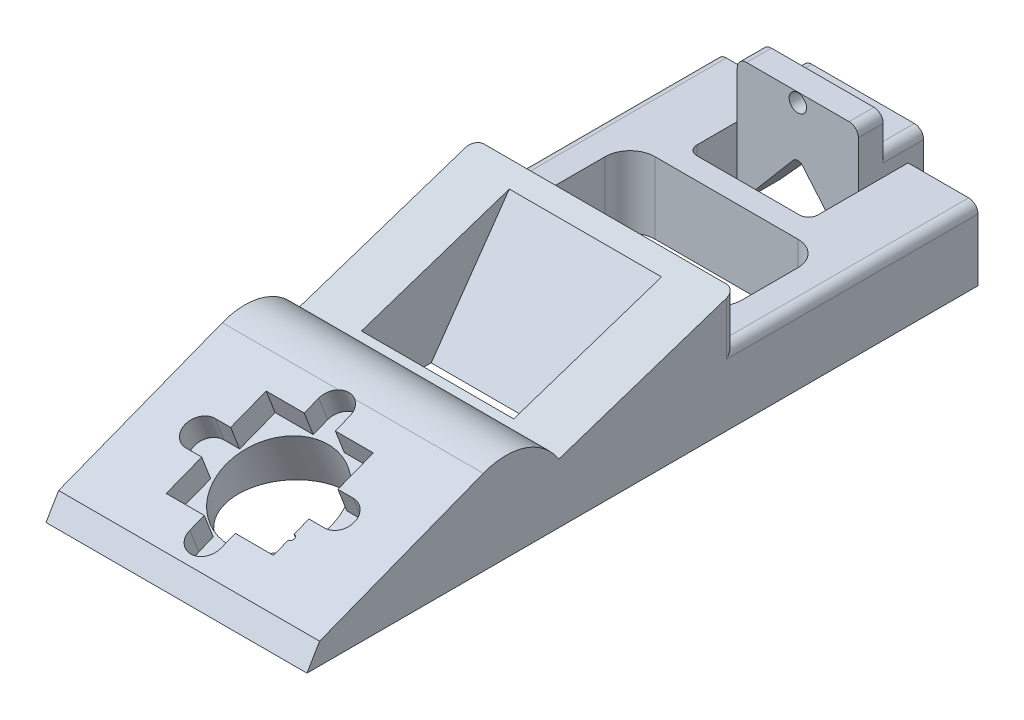
from build123d import *

# Parameters (mm, degrees)
EXTRUDE_1_DEPTH          = 19
CUT_EXTRUDE_1_REACH      = 60.798
CUT_EXTRUDE_2_DEPTH      = 19
SKETCH_5_W               = 19.5
SKETCH_5_H               = 3.999999999999993
EXTRUDE_2_DEPTH          = 9
EXTRUDE_3_DEPTH          = 3.5
EXTRUDE_3_DEPTH_BACK     = 11.5
CUT_EXTRUDE_3_REACH      = 83.003
FILLET_1_R               = 1.5
FILLET_2_R               = 1
CUT_EXTRUDE_4_DEPTH      = 19.999999999999996
FILLET_3_R               = 1.5
CUT_EXTRUDE_15_DEPTH     = 2
SKETCH_18_R              = 0.7500000000000009
CUT_EXTRUDE_16_DEPTH     = 4
SKETCH_20_R              = 0.7500000000000004
CUT_EXTRUDE_18_DEPTH     = 4
CUT_EXTRUDE_18_DRAFT     = -5.000000000000011
MIRROR_1_COPY_1_SKETCH_R = 0.7500000000000004
MIRROR_1_COPY_1_DEPTH    = 4
MIRROR_1_COPY_1_DRAFT    = -5.000000000000011
FILLET_7_R               = 1.5
CUT_EXTRUDE_22_DEPTH     = 24.000000000000007
EXTRUDE_4_DEPTH          = 42
SKETCH_24_R              = 2.499999999999999
SKETCH_24_R_2            = 2.500000000000004
CUT_EXTRUDE_23_DEPTH     = 4
SKETCH_25_R              = 8.5
CUT_EXTRUDE_24_DEPTH     = 70.91291338858937
CUT_EXTRUDE_25_DEPTH     = 70.94027802815528
EXTRUDE_5_DEPTH          = 24.5
FILLET_8_R               = 10
CUT_EXTRUDE_26_DEPTH     = 36.000000000000014


with BuildPart() as part:
    # 草图1 → 凸台-拉伸1 (new body)
    with BuildSketch(Plane(origin=(0, 0, 0), x_dir=(1, 0, 0), z_dir=(0, 1, 0))):
        Polygon((-20.999999999999996, 36.499999999999986), (21.000000000000004, 36.499999999999986), (21.00000000000001, -36.500000000000014), (-20.999999999999986, -36.500000000000014), align=None)
    extrude(amount=EXTRUDE_1_DEPTH)

    # 草图3 → 切除-拉伸1 (cut, up to next)
    with BuildSketch(Plane.ZY.offset(20.999999999999993), mode=Mode.PRIVATE) as cut_extrude_1_sk1:
        Polygon((-36.499999999999986, 19), (-36.499999999999986, 11.5), (2.500000000000014, 11.5), (2.500000000000016, 19), align=None)
    cut_extrude_1_tool1 = extrude(cut_extrude_1_sk1.sketch, amount=-CUT_EXTRUDE_1_REACH, mode=Mode.PRIVATE) & part.part
    # 草图3 → 切除-拉伸1 (cut, up to next)
    with BuildSketch(Plane.ZY.offset(20.999999999999993), mode=Mode.PRIVATE) as cut_extrude_1_sk2:
        Polygon((36.500000000000014, 19), (2.500000000000014, 19), (30.977695197165154, 9.564912493391638), (36.500000000000014, 0), align=None)
    cut_extrude_1_tool2 = extrude(cut_extrude_1_sk2.sketch, amount=-CUT_EXTRUDE_1_REACH, mode=Mode.PRIVATE) & part.part
    add(cut_extrude_1_tool1.solids().sort_by_distance((-21, 15.25, -17))[0], mode=Mode.SUBTRACT)
    add(cut_extrude_1_tool2.solids().sort_by_distance((-21, 14.294033, 26.119155))[0], mode=Mode.SUBTRACT)

    # 草图4 → 切除-拉伸2 (cut)
    with BuildSketch(Plane(origin=(0, 11.5, 0), x_dir=(1, 0, 0), z_dir=(0, 1, 0))):
        with BuildLine():
            ThreePointArc((-8.249999999999991, 20.499999999999986), (-9.310660171779816, 20.939339828220167), (-9.749999999999991, 21.99999999999999))
            Line((-9.749999999999991, 21.99999999999999), (-9.749999999999991, 28.49999999999999))
            Line((-9.749999999999991, 28.49999999999999), (9.750000000000009, 28.49999999999999))
            Line((9.750000000000009, 28.49999999999999), (9.750000000000009, 21.999999999999993))
            ThreePointArc((9.750000000000009, 21.999999999999993), (9.31066017177983, 20.93933982822017), (8.250000000000009, 20.49999999999999))
            Line((8.250000000000009, 20.49999999999999), (-8.249999999999991, 20.499999999999986))
        make_face()
    extrude(amount=-CUT_EXTRUDE_2_DEPTH, mode=Mode.SUBTRACT)

    # 草图5 → 凸台-拉伸2 (add)
    with BuildSketch(Plane(origin=(0, 11.5, 0), x_dir=(1, 0, 0), z_dir=(0, 1, 0))):
        with Locations((8.88e-15, 30.49999999999999)):
            Rectangle(SKETCH_5_W, SKETCH_5_H)
    extrude(amount=EXTRUDE_2_DEPTH)

    # 草图6 → 凸台-拉伸3 (add, two sides: drawn at the far end of the back side and taken through both)
    with BuildSketch(Plane(origin=(0, 11.5, 0), x_dir=(1, 0, 0), z_dir=(0, 1, 0)).offset(-EXTRUDE_3_DEPTH_BACK)):
        Polygon((-9.749999999999991, 32.499999999999986), (-9.749999999999991, 38.999999999999986), (9.750000000000007, 38.999999999999986), (9.750000000000009, 32.499999999999986), align=None)
    extrude(amount=EXTRUDE_3_DEPTH + EXTRUDE_3_DEPTH_BACK)

    # 草图7 → 切除-拉伸3 (cut, up to next)
    with BuildSketch(Plane(origin=(0, 0, -38.999999999999986), x_dir=(-1, 0, 0), z_dir=(0, 0, -1)), mode=Mode.PRIVATE) as cut_extrude_3_sk1:
        Polygon((0, 11.500000000000002), (9.749999999999991, 0), (-9.750000000000007, -6.94e-15), align=None)
    cut_extrude_3_tool1 = extrude(cut_extrude_3_sk1.sketch, amount=-CUT_EXTRUDE_3_REACH, mode=Mode.PRIVATE) & part.part
    add(cut_extrude_3_tool1.solids().sort_by_distance((0, 3.833333, -39))[0], mode=Mode.SUBTRACT)

    # 圆角1
    fillet_1_edges = [part.edges().sort_by_distance(p)[0] for p in [
        (9.750000000000009, 20.5, -30.499999999999986),
        (-9.749999999999991, 20.5, -30.499999999999986),
        (9.750000000000007, 15, -35.749999999999986),
        (-9.749999999999991, 15, -35.749999999999986),
    ]]
    fillet(fillet_1_edges, radius=FILLET_1_R)

    # 圆角2
    fillet_2_edges = [part.edges().sort_by_distance(p)[0] for p in [
        (0, 11.500000000000002, -33.749999999999986),
    ]]
    fillet(fillet_2_edges, radius=FILLET_2_R)

    # 草图8 → 切除-拉伸4 (cut)
    with BuildSketch(Plane(origin=(9.750000000000009, 0, 0), x_dir=(0, 0, -1), z_dir=(1, 0, 0))):
        Polygon((36.499999999999986, 0), (38.999999999999986, 4), (38.999999999999986, 0), align=None)
    extrude(amount=-CUT_EXTRUDE_4_DEPTH, mode=Mode.SUBTRACT)

    # 圆角3
    fillet_3_edges = [part.edges().sort_by_distance(p)[0] for p in [
        (8.054347826086955, 2.0000000000000036, -37.74999999999998),
        (-8.054347826086952, 1.9999999999999991, -37.749999999999986),
    ]]
    fillet(fillet_3_edges, radius=FILLET_3_R)

    # 草图17 → 切除-拉伸15 (cut)
    with BuildSketch(Plane(origin=(0, 0, -28.49999999999999), x_dir=(-1, 0, 0), z_dir=(0, 0, -1))):
        with BuildLine():
            ThreePointArc((1.39999999999999, 18.999999999999996), (-8.59e-15, 20.399999999999995), (-1.4000000000000072, 18.999999999999996))
            Line((-1.4000000000000075, 18.999999999999996), (1.3999999999999897, 18.999999999999996))
        make_face()
        with BuildLine():
            Line((1.3999999999999897, 18.999999999999996), (-1.4000000000000075, 18.999999999999996))
            ThreePointArc((-1.4000000000000072, 18.999999999999996), (-8.93e-15, 17.599999999999998), (1.39999999999999, 18.999999999999996))
        make_face()
    extrude(amount=CUT_EXTRUDE_15_DEPTH, mode=Mode.SUBTRACT)

    # 草图18 → 切除-拉伸16 (cut)
    with BuildSketch(Plane.XY.offset(-30.499999999999993)):
        with Locations((8.67e-15, 18.999999999999996)):
            Circle(SKETCH_18_R)
    extrude(amount=-CUT_EXTRUDE_16_DEPTH, mode=Mode.SUBTRACT)


with BuildPart() as cut_extrude_18_tool:
    # 草图20 → 切除-拉伸18 (with draft: the straight prism first)
    with BuildSketch(Plane(origin=(0, 0, -36.499999999999986), x_dir=(-1, 0, 0), z_dir=(0, 0, -1))):
        with Locations((-15.250000000000005, 5.75)):
            Circle(SKETCH_20_R)
    extrude(amount=-CUT_EXTRUDE_18_DEPTH)
    # 切除-拉伸18: the draft: its side faces are tilted about the plane it starts from
    cut_extrude_18_sides = [cut_extrude_18_tool.faces().sort_by_distance(p)[0] for p in [
        (16, 5.75, -34.5),
    ]]
    draft(cut_extrude_18_sides, Plane(origin=(0, 0, -36.499999999999986), x_dir=(-1, 0, 0), z_dir=(0, 0, -1)), CUT_EXTRUDE_18_DRAFT)


with BuildPart() as part_1:
    add(part.part)

    # 切除-拉伸18: cut by cut_extrude_18_tool
    add(cut_extrude_18_tool.part, mode=Mode.SUBTRACT)


with BuildPart() as mirror_1_copy_1_tool:
    # 镜向1 copy 1 sketch → 镜向1 copy 1 (with draft: the straight prism first)
    with BuildSketch(Plane(origin=(0, 0, -36.499999999999986), x_dir=(1, 0, 0), z_dir=(0, 0, -1))):
        with Locations((-15.250000000000005, -5.75)):
            Circle(MIRROR_1_COPY_1_SKETCH_R)
    extrude(amount=-MIRROR_1_COPY_1_DEPTH)
    # 镜向1 copy 1: the draft: its side faces are tilted about the plane it starts from
    mirror_1_copy_1_sides = [mirror_1_copy_1_tool.faces().sort_by_distance(p)[0] for p in [
        (-16, 5.75, -34.5),
    ]]
    draft(mirror_1_copy_1_sides, Plane(origin=(0, 0, -36.499999999999986), x_dir=(1, 0, 0), z_dir=(0, 0, -1)), MIRROR_1_COPY_1_DRAFT)


with BuildPart() as part_2:
    add(part_1.part)

    # 镜向1 copy 1: cut by mirror_1_copy_1_tool
    add(mirror_1_copy_1_tool.part, mode=Mode.SUBTRACT)

    # 圆角7
    fillet_7_edges = [part_2.edges().sort_by_distance(p)[0] for p in [
        (-20.999999999999996, 11.5, -16.999999999999982),
        (-20.999999999999993, 15.25, 2.500000000000019),
        (21.000000000000007, 15.25, 2.5000000000000138),
        (21.000000000000007, 11.5, -16.999999999999986),
    ]]
    fillet(fillet_7_edges, radius=FILLET_7_R)

    # 草图21 → 切除-拉伸22 (cut)
    with BuildSketch(Plane.XZ):
        Polygon((-12.24999999999999, 29.47769519716515), (-12.24999999999999, 5.683244946958155), (12.250000000000012, 5.683244946958155), (12.25000000000001, 29.477695197165154), align=None)
    extrude(amount=-CUT_EXTRUDE_22_DEPTH, mode=Mode.SUBTRACT)

    # 草图23 → 凸台-拉伸4 (add)
    with BuildSketch(Plane(origin=(21.000000000000007, 0, -2e-15), x_dir=(-1e-16, 0, -1), z_dir=(1, 0, -1e-16))):
        Polygon((-30.977695197165158, 9.564912493391638), (-30.977695197165158, 18.364912493391635), (-69.46824654038242, 3.445573664766443), (-71.50000000000001, 0), (-36.50000000000001, 0), align=None)
    extrude(amount=-EXTRUDE_4_DEPTH)

    # 草图24 → 切除-拉伸23 (cut)
    with BuildSketch(Plane(origin=(9.7e-16, 26.405047147072228, 10.23487145352138), x_dir=(1, -3e-17, -1e-17), z_dir=(0, 0.9324067733233699, 0.36141058238615825))):
        Polygon((-9.624999999999988, -57.15239682031271), (-9.624999999999988, -39.90239682031272), (7.625000000000015, -39.90239682031271), (7.625000000000015, -57.15239682031271), align=None)
        with Locations((10.125000000000002, -48.527396820312816)):
            Circle(SKETCH_24_R)
        with BuildLine():
            Line((7.625000000000015, -48.527396820312816), (7.625000000000015, -51.0273968203127))
            Line((7.625000000000007, -51.0273968203127), (10.125000000000009, -51.0273968203127))
            ThreePointArc((10.125000000000007, -51.027396820312816), (8.357233047033636, -50.295163773279185), (7.625000000000003, -48.527396820312816))
        make_face()
        with BuildLine():
            Line((7.625000000000015, -46.0273968203127), (7.625000000000015, -48.527396820312816))
            ThreePointArc((7.625000000000003, -48.527396820312816), (8.357233047033636, -46.75962986734645), (10.125000000000009, -46.027396820312816))
            Line((10.125000000000009, -46.0273968203127), (7.625000000000013, -46.0273968203127))
        make_face()
        with Locations((-12.12499999999999, -48.52739682031258)):
            Circle(SKETCH_24_R)
        with BuildLine():
            Line((-12.124999999999996, -51.027396820312674), (-9.624999999999988, -51.02739682031271))
            Line((-9.624999999999988, -51.02739682031271), (-9.624999999999988, -48.52739682031258))
            ThreePointArc((-9.62499999999999, -48.52739682031258), (-10.357233047033622, -50.29516377327895), (-12.124999999999996, -51.02739682031258))
        make_face()
        with BuildLine():
            ThreePointArc((-12.124999999999977, -46.02739682031258), (-10.357233047033617, -46.75962986734622), (-9.62499999999999, -48.52739682031258))
            Line((-9.624999999999988, -48.52739682031258), (-9.624999999999988, -46.0273968203127))
            Line((-9.624999999999988, -46.0273968203127), (-12.124999999999977, -46.027396820312674))
        make_face()
        with Locations((-0.9999999999999847, -37.40239682031271)):
            Circle(SKETCH_24_R_2)
        with BuildLine():
            Line((-0.9999999434812805, -39.90239682031271), (1.500000000000015, -39.90239682031271))
            Line((1.500000000000015, -39.90239682031272), (1.500000000000015, -37.40239682031271))
            ThreePointArc((1.5000000000000193, -37.40239682031271), (0.7677669729487664, -39.1701637532967), (-0.9999999434812799, -39.90239682031272))
        make_face()
        with BuildLine():
            Line((-3.499999999999985, -39.90239682031272), (-0.9999999434812805, -39.90239682031271))
            ThreePointArc((-0.9999999434812799, -39.90239682031272), (-2.7677669329839762, -39.17016379326146), (-3.4999999999999885, -37.40239682031271))
            Line((-3.499999999999984, -37.40239682031271), (-3.499999999999984, -39.90239682031271))
        make_face()
        with Locations((-1.000000000000067, -59.65239682031271)):
            Circle(SKETCH_24_R_2)
        with BuildLine():
            ThreePointArc((-1.0000000349305498, -57.1523968203127), (0.7677669406165137, -57.88462985499655), (1.499999999999937, -59.65239682031271))
            Line((1.500000000000015, -59.6523968203127), (1.500000000000015, -57.1523968203127))
            Line((1.500000000000015, -57.15239682031271), (-1.00000003493055, -57.15239682031271))
        make_face()
        with BuildLine():
            Line((-3.499999999999984, -57.15239682031271), (-3.499999999999984, -59.6523968203127))
            ThreePointArc((-3.500000000000071, -59.65239682031271), (-2.767766965316229, -57.88462987969613), (-1.0000000349305498, -57.1523968203127))
            Line((-1.00000003493055, -57.15239682031271), (-3.499999999999985, -57.15239682031271))
        make_face()
    extrude(amount=-CUT_EXTRUDE_23_DEPTH, mode=Mode.SUBTRACT)

    # 草图25 → 切除-拉伸24 (cut, through all)
    with BuildSketch(Plane(origin=(-6.7e-16, 22.67542005377876, 8.789229123976755), x_dir=(1, 3e-17, 1e-17), z_dir=(0, 0.9324067733233699, 0.3614105823861583))):
        with Locations(Location((-0.9999999999999868, -48.52739682031273, 0), (0, 0, 270))):
            Circle(SKETCH_25_R)
    extrude(amount=-CUT_EXTRUDE_24_DEPTH, mode=Mode.SUBTRACT)

    # 草图27 → 切除-拉伸25 (cut, through all)
    with BuildSketch(Plane(origin=(9.7e-16, 26.405047147072228, 10.23487145352138), x_dir=(1, -3e-17, -1e-17), z_dir=(0, 0.9324067733233699, 0.36141058238615825))):
        with BuildLine():
            ThreePointArc((7.625, -53.58989682031273), (7.125000000000012, -54.08989682031273), (7.624999999999999, -54.58989682031273))
            Line((7.625000000000016, -54.58989682031273), (7.625000000000016, -53.58989682031273))
        make_face()
        with BuildLine():
            Line((7.625000000000016, -53.58989682031273), (7.625000000000016, -54.58989682031273))
            ThreePointArc((7.624999999999999, -54.58989682031273), (7.978553390593286, -54.443450210906015), (8.12500000000002, -54.08989682031273))
            ThreePointArc((8.12500000000002, -54.08989682031273), (7.978553390593286, -53.73634342971945), (7.625, -53.58989682031273))
        make_face()
    extrude(amount=-CUT_EXTRUDE_25_DEPTH, mode=Mode.SUBTRACT)

    # 草图28 → 凸台-拉伸5 (add)
    with BuildSketch(Plane(origin=(-12.24999999999999, 0, 0), x_dir=(0, 0, -1), z_dir=(1, 0, 0))):
        Polygon((-5.683244946958155, 0), (-5.683244946958155, 17.94534320907723), (-18.248709537714582, 0), align=None)
    extrude(amount=EXTRUDE_5_DEPTH)

    # 圆角8
    # the kernel refuses this fillet: 10 mm, written as the material it takes off along each edge
    with BuildSketch(Plane(origin=(53.54506406890172, 18.364912493391635, 30.97769519716515), x_dir=(0, -1, -4e-16), z_dir=(-1, 0, 1e-16))) as fillet_8_piece_1:
        with BuildLine():
            CenterArc((14.028919956808336, 8.523989446573212), FILLET_8_R, 158.81314998741195, 79.6604084684634)
            Line((4.704852223574637, 12.138095270434794), (4.5183708689099635, 12.210377386912027))
            Line((4.5183708689099635, 12.210377386912027), (-0.1864813546646751, 0.07228211647723264))
            Line((-0.1864813546646751, 0.07228211647723264), (8e-17, -0.1999999999999993))
            ThreePointArc((8e-17, -0.1999999999999993), (4.399999999999999, -0.1999999999999975), (8.695421600863831, -0.1704797889314627))
            Line((8.695421600863831, -0.1704797889314627), (8.799999999999997, 0))
        make_face()
    extrude(amount=107.09012813780342, mode=Mode.SUBTRACT)

    # 草图30 → 切除-拉伸26 (cut)
    with BuildSketch(Plane(origin=(0, 11.5, 0), x_dir=(1, 0, 0), z_dir=(0, 1, 0))):
        with BuildLine():
            Line((11.499999999999979, -8.4e-16), (-11.499999999999968, -3.66e-15))
            ThreePointArc((-11.499999999999968, -3.66e-15), (-14.328427124746186, 1.1715728752538062), (-15.499999999999996, 4.000000000000024))
            Line((-15.499999999999996, 4.000000000000024), (-15.499999999999996, 12.999999999999948))
            ThreePointArc((-15.499999999999996, 12.999999999999948), (-14.328427124746188, 15.828427124746169), (-11.499999999999968, 16.99999999999998))
            Line((-11.499999999999968, 16.99999999999998), (11.499999999999975, 16.999999999999982))
            ThreePointArc((11.499999999999975, 16.999999999999982), (14.328427124746195, 15.828427124746174), (15.500000000000005, 12.999999999999956))
            Line((15.500000000000005, 12.999999999999956), (15.500000000000007, 4.000000000000028))
            ThreePointArc((15.500000000000007, 4.000000000000028), (14.328427124746197, 1.1715728752538093), (11.499999999999979, -8.4e-16))
        make_face()
    extrude(amount=-CUT_EXTRUDE_26_DEPTH, mode=Mode.SUBTRACT)


solid = part_2.part
